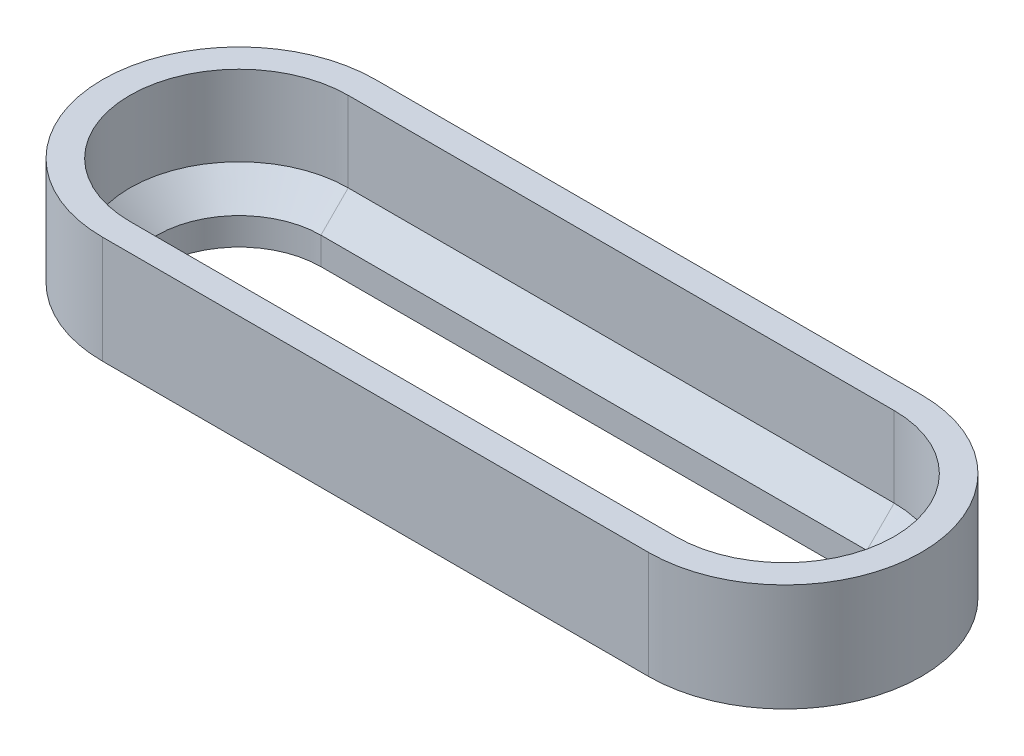
from build123d import *

# Parameters (mm, degrees)
BOSS_EXTRUDE1_DEPTH      = 10
BOSS_EXTRUDE2_DEPTH      = 2.54
BOSS_EXTRUDE2_DEPTH_BACK = 2.54
CHAMFER1_SIZE            = 2.54


with BuildPart() as part:
    # Sketch1 → Boss-Extrude1 (new body)
    with BuildSketch(Plane(origin=(0, 0, 0), x_dir=(1, 0, 0), z_dir=(0, 1, 0))):
        with BuildLine():
            Line((-25.4, -12.7), (25.4, -12.7))
            ThreePointArc((25.4, -12.7), (38.1, 0), (25.4, 12.7))
            Line((25.4, 12.7), (-25.4, 12.7))
            ThreePointArc((-25.4, 12.7), (-38.1, 0), (-25.4, -12.7))
        make_face()
        with BuildLine():
            Line((-25.4, -10.16), (25.4, -10.16))
            ThreePointArc((25.4, -10.16), (35.56, 0), (25.4, 10.16))
            Line((25.4, 10.16), (-25.4, 10.16))
            ThreePointArc((-25.4, 10.16), (-35.56, 0), (-25.4, -10.16))
        make_face(mode=Mode.SUBTRACT)
    extrude(amount=BOSS_EXTRUDE1_DEPTH)

    # Sketch3 → Boss-Extrude2 (add, two sides: drawn at the far end of the back side and taken through both)
    with BuildSketch(Plane.XZ.offset(-BOSS_EXTRUDE2_DEPTH_BACK)):
        with BuildLine():
            Line((25.4, 10.16), (-25.4, 10.16))
            ThreePointArc((-25.4, 10.16), (-35.56, 0), (-25.4, -10.16))
            Line((-25.4, -10.16), (25.4, -10.16))
            ThreePointArc((25.4, -10.16), (35.56, 0), (25.4, 10.16))
        make_face()
        with BuildLine():
            Line((-25.4, -7.62), (25.4, -7.62))
            ThreePointArc((25.4, -7.62), (33.02, 0), (25.4, 7.62))
            Line((25.4, 7.62), (-25.4, 7.62))
            ThreePointArc((-25.4, 7.62), (-33.02, 0), (-25.4, -7.62))
        make_face(mode=Mode.SUBTRACT)
    extrude(amount=BOSS_EXTRUDE2_DEPTH + BOSS_EXTRUDE2_DEPTH_BACK)

    # Chamfer1
    chamfer1_edges = [part.edges().sort_by_distance(p)[0] for p in [
        (35.56, -2.54, 0),
        (0, -2.54, 10.16),
        (0, -2.54, -10.16),
        (-35.56, -2.54, 0),
        (0, 2.54, 7.62),
        (-33.02, 2.54, 0),
        (33.02, 2.54, 0),
        (0, 2.54, -7.62),
    ]]
    chamfer(chamfer1_edges, length=CHAMFER1_SIZE - 0.0001)  # a hair under: the kernel refuses the full size


solid = part.part
